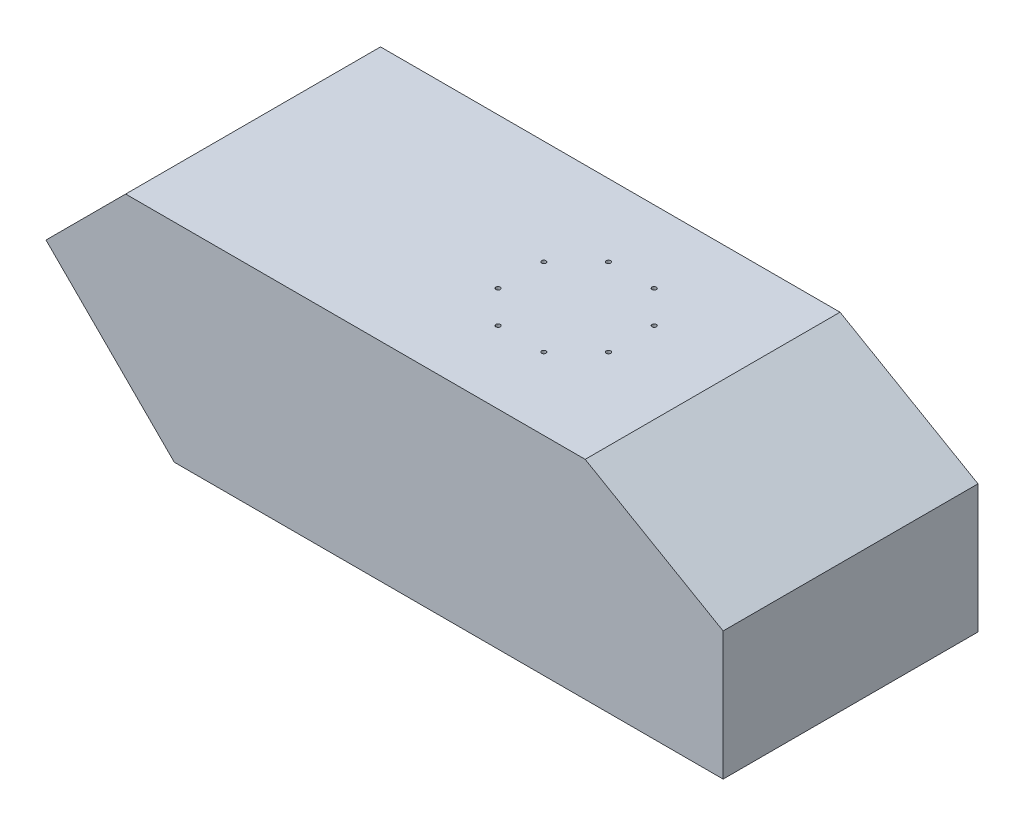
from build123d import *

# Parameters (mm, degrees)
SALIENTE_EXTRUIR2_DEPTH          = 160
TALADRO_DE_MARGEN_PARA_M51_D     = 5.5
TALADRO_DE_MARGEN_PARA_M51_DEPTH = 22
TALADRO_DE_MARGEN_PARA_M51_TIP   = 1.652366702


with BuildPart() as part:
    # Croquis3 → Saliente-Extruir2 (new, symmetric)
    with BuildSketch(Plane.XY):
        Polygon((-344.53, -161.11), (344.53, -161.11), (344.53, 0), (171.324919243, 100), (-405.64, 100), (-505.64, 0), align=None)
    extrude(amount=SALIENTE_EXTRUIR2_DEPTH, both=True)

    # Taladro de margen para M51
    with Locations(Plane(origin=(0, 100, 0), x_dir=(1, 0, 0), z_dir=(0, 1, 0))):
        with Locations((28.701257427, 69.290964938), (69.290964938, 28.701257427), (69.290964938, -28.701257427), (28.701257427, -69.290964938), (-28.701257427, -69.290964938), (-69.290964938, -28.701257427), (-69.290964938, 28.701257427), (-28.701257427, 69.290964938)):
            Hole(TALADRO_DE_MARGEN_PARA_M51_D / 2, depth=TALADRO_DE_MARGEN_PARA_M51_DEPTH)
            with Locations((0, 0, -(TALADRO_DE_MARGEN_PARA_M51_DEPTH + TALADRO_DE_MARGEN_PARA_M51_TIP / 2))):  # 118° drill point
                Cone(0, TALADRO_DE_MARGEN_PARA_M51_D / 2, TALADRO_DE_MARGEN_PARA_M51_TIP, mode=Mode.SUBTRACT)


solid = part.part
